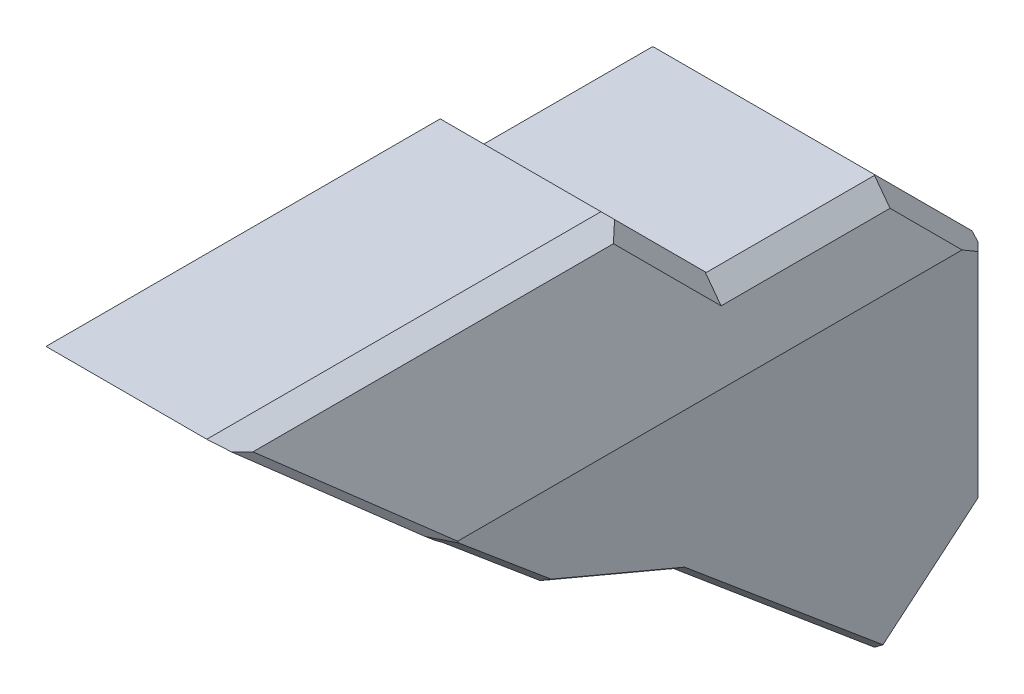
from build123d import *
from OCP.BRepFilletAPI import BRepFilletAPI_MakeChamfer

# Parameters (mm, degrees)
EXTRUDE_1_DEPTH          = 250
EXTRUDE_1_2_DEPTH        = 250
CUT_EXTRUDE_1_DEPTH      = 273.642623227
CUT_EXTRUDE_1_DEPTH_BACK = 273.642623227
EXTRUDE_5_REACH          = 274.643
EXTRUDE_6_REACH          = 274.643
EXTRUDE_13_DEPTH         = 52
SKETCH_15_W              = 2
SKETCH_15_H              = 5
SKETCH_15_W_2            = 4
SKETCH_15_H_2            = 2
EXTRUDE_14_DEPTH         = 12
SKETCH_16_W              = 10
SKETCH_16_H              = 32
EXTRUDE_15_DEPTH         = 12
CUT_EXTRUDE_2_REACH      = 279.173
SKETCH_17_R              = 1.5
SKETCH_18_R              = 1.5
SKETCH_18_R_2            = 4.615350253
CUT_EXTRUDE_3_DEPTH      = 10
CHAMFER_1_SIZE           = 3.464101615
CHAMFER_1_SIZE_2         = 2
CHAMFER_1_SIZE_3         = 2.416402179
CHAMFER_2_SIZE           = 4
CHAMFER_2_SIZE2          = 5.580634967
CHAMFER_2_SIZE2_2        = 6.901718256
CHAMFER_4_SIZE           = 2


with BuildPart() as part:
    # 草图2 → 凸台-拉伸1 (new body)
    with BuildSketch(Plane.XY):
        Polygon((-53, 45), (-34, 95), (-30.790701011, 95), (-50, 44.449213187), (-50, -65), (-53, -65), align=None)
    extrude(amount=EXTRUDE_1_DEPTH)


with BuildPart() as body_2:
    # 草图2 → Extrude 1 2 (new body)
    with BuildSketch(Plane.XY):
        Polygon((50, 44.449213187), (50, -65), (53, -65), (53, 45), (34, 95), (30.790701011, 95), align=None)
    extrude(amount=EXTRUDE_1_2_DEPTH)


with BuildPart() as cut_extrude_1_tool:
    # 草图3 → 切除-拉伸1 (new, two sides: drawn at the far end of the back side and taken through both)
    with BuildSketch(Plane(origin=(0, 0, 0), x_dir=(0, 0, -1), z_dir=(1, 0, 0)).offset(-CUT_EXTRUDE_1_DEPTH_BACK)):
        Polygon((0, -35), (-35.752607778, -65), (-107.257823333, -5), (-154.659712592, 15), (-250, 95), (-250, -65), (-250, -69.557889813), (0, -69.557889813), (0, -65), align=None)
        Polygon((-110, 95), (-85, 70), (-25, 70), (0, 45), (0, 95), align=None)
    extrude(amount=CUT_EXTRUDE_1_DEPTH + CUT_EXTRUDE_1_DEPTH_BACK)


with BuildPart() as part_1:
    add(part.part)

    # 切除-拉伸1: cut by cut_extrude_1_tool
    add(cut_extrude_1_tool.part, mode=Mode.SUBTRACT)

    # 草图5<2> → 凸台-拉伸6 (add, up to next)
    with BuildSketch(Plane(origin=(0, 0, 0), x_dir=(0, 0, -1), z_dir=(1, 0, 0)), mode=Mode.PRIVATE) as extrude_6_sk1:
        Polygon((-250, 95), (-110, 95), (-85, 70), (-25, 70), (0, 45), (0, -35), (-4, -35), (-4, 43.343145751), (-26.656854249, 66), (-86.656854249, 66), (-111.656854249, 91), (-245.23298563, 91), align=None)
    extrude_6_tool1 = extrude(extrude_6_sk1.sketch, amount=-EXTRUDE_6_REACH, mode=Mode.PRIVATE) - part_1.part


with BuildPart() as body_2_1:
    add(body_2.part)

    # 切除-拉伸1: cut by cut_extrude_1_tool
    add(cut_extrude_1_tool.part, mode=Mode.SUBTRACT)

    # 草图5 → 凸台-拉伸5 (add, up to next)
    with BuildSketch(Plane(origin=(0, 0, 0), x_dir=(0, 0, -1), z_dir=(1, 0, 0)), mode=Mode.PRIVATE) as extrude_5_sk1:
        Polygon((-250, 95), (-110, 95), (-85, 70), (-25, 70), (0, 45), (0, -35), (-4, -35), (-4, 43.343145751), (-26.656854249, 66), (-86.656854249, 66), (-111.656854249, 91), (-245.23298563, 91), align=None)
    extrude_5_tool1 = extrude(extrude_5_sk1.sketch, amount=EXTRUDE_5_REACH, mode=Mode.PRIVATE) - body_2_1.part
    add(extrude_5_tool1.solids().sort_by_distance((0, 92.182199, 180))[0])


with BuildPart() as part_2:
    add(part_1.part)

    add(body_2_1.part)  # 凸台-拉伸6 merges body 2
    add(extrude_6_tool1.solids().sort_by_distance((0, 92.182199, 180))[0])

    # 草图13 → 凸台-拉伸13 (add)
    with BuildSketch(Plane.XY.offset(4)):
        Polygon((-5, 15), (35.7, 15), (35.7, -15), (-5, -15), (-5, -19), (38.7, -19), (38.7, 18), (-5, 18), align=None)
    extrude(amount=EXTRUDE_13_DEPTH)

    # 草图15 → 凸台-拉伸14 (add)
    with BuildSketch(Plane.XY.offset(4)):
        with Locations((29.7, 12.5)):
            Rectangle(SKETCH_15_W, SKETCH_15_H)
        with Locations((29.7, -12.5)):
            Rectangle(SKETCH_15_W, SKETCH_15_H)
        with Locations((-10, 0)):
            Rectangle(SKETCH_15_W_2, SKETCH_15_H_2)
    extrude(amount=EXTRUDE_14_DEPTH)

    # 草图16 → 凸台-拉伸15 (add)
    with BuildSketch(Plane.XY.offset(4)):
        with Locations((-24.8, 0)):
            Rectangle(SKETCH_16_W, SKETCH_16_H)
    extrude(amount=EXTRUDE_15_DEPTH)

    # 草图17 → 切除-拉伸2 (cut, up to next)
    with BuildSketch(Plane(origin=(-19.8, 0, 0), x_dir=(0, 0, -1), z_dir=(1, 0, 0)), mode=Mode.PRIVATE) as cut_extrude_2_sk1:
        with Locations(Location((-11.5, 8.5, 0), (0, 0, 90))):
            Circle(SKETCH_17_R)
    cut_extrude_2_tool1 = extrude(cut_extrude_2_sk1.sketch, amount=-CUT_EXTRUDE_2_REACH, mode=Mode.PRIVATE) & part_2.part
    # 草图17 → 切除-拉伸2 (cut, up to next)
    with BuildSketch(Plane(origin=(-19.8, 0, 0), x_dir=(0, 0, -1), z_dir=(1, 0, 0)), mode=Mode.PRIVATE) as cut_extrude_2_sk2:
        with Locations(Location((-11.5, -8.5, 0), (0, 0, 90))):
            Circle(SKETCH_17_R)
    cut_extrude_2_tool2 = extrude(cut_extrude_2_sk2.sketch, amount=-CUT_EXTRUDE_2_REACH, mode=Mode.PRIVATE) & part_2.part
    add(cut_extrude_2_tool1.solids().sort_by_distance((-19.8, 8.5, 11.5))[0], mode=Mode.SUBTRACT)
    add(cut_extrude_2_tool2.solids().sort_by_distance((-19.8, -8.5, 11.5))[0], mode=Mode.SUBTRACT)

    # 草图18 → 切除-拉伸3 (cut)
    with BuildSketch(Plane(origin=(0, 0, 0), x_dir=(-1, 0, 0), z_dir=(0, 0, -1))):
        with Locations((20.5, 0)):
            Circle(SKETCH_18_R)
        with Locations((14.495689014, -14.495689014)):
            Circle(SKETCH_18_R)
        with Locations((0, -20.5)):
            Circle(SKETCH_18_R)
        with Locations((-14.495689014, -14.495689014)):
            Circle(SKETCH_18_R)
        with Locations((-20.5, 0)):
            Circle(SKETCH_18_R)
        with Locations((-14.495689014, 14.495689014)):
            Circle(SKETCH_18_R)
        with Locations((0, 20.5)):
            Circle(SKETCH_18_R)
        with Locations((14.495689014, 14.495689014)):
            Circle(SKETCH_18_R)
        Circle(SKETCH_18_R_2)
    extrude(amount=-CUT_EXTRUDE_3_DEPTH, mode=Mode.SUBTRACT)

    # 倒角1
    # the kernel refuses this chamfer: 3.464101615, 2.416402179, 2 mm, written as the material it takes off along each edge
    with BuildSketch(Plane(origin=(53, 9.239383761, 147.794477493), x_dir=(-1, 0, 0), z_dir=(0, 0.6427876096865404, 0.7660444431189771))) as chamfer_1_piece_1:
        Polygon((CHAMFER_1_SIZE, 0), (0, -CHAMFER_1_SIZE_2), (0, 0), align=None)
    extrude(amount=70.868920247, mode=Mode.SUBTRACT)
    with BuildSketch(Plane(origin=(53, -8.483850163, 99.000769351), x_dir=(-3.552713678800504e-15, 0.9213479550614352, -0.38873891714634334), z_dir=(0, 0.38873891714634334, 0.9213479550614352))) as chamfer_1_piece_2_section:
        Polygon((CHAMFER_1_SIZE_2, 0), (0, CHAMFER_1_SIZE), (0, 0), align=None)
    chamfer_1_piece_2 = extrude(amount=69.37226796, mode=Mode.PRIVATE)
    chamfer_1_piece_2 = split(chamfer_1_piece_2, bisect_by=Plane(origin=(53.276585969, -8.850832142, 99.308703795), z_dir=(0.49999999999999917, -0.663413948168938, 0.5566703992264205)), keep=Keep.TOP, mode=Mode.PRIVATE)
    add(chamfer_1_piece_2, mode=Mode.SUBTRACT)
    with BuildSketch(Plane(origin=(53, -70.760616239, 28.887372679), x_dir=(-3.5527136788004907e-15, 0.7660444431189773, -0.6427876096865404), z_dir=(0, 0.6427876096865404, 0.7660444431189772))) as chamfer_1_piece_3_section:
        Polygon((CHAMFER_1_SIZE_2, 0), (0, CHAMFER_1_SIZE), (0, 0), align=None)
    chamfer_1_piece_3 = extrude(amount=111.267285494, mode=Mode.PRIVATE)
    chamfer_1_piece_3 = split(chamfer_1_piece_3, bisect_by=Plane(origin=(39.090434661, -48.563433238, 19.521845967), z_dir=(0.49999999999999994, -0.7979107348080464, 0.33665777768838756)), keep=Keep.TOP, mode=Mode.PRIVATE)
    add(chamfer_1_piece_3, mode=Mode.SUBTRACT)
    with BuildSketch(Plane(origin=(53, -29.239383761, -6.865235099), x_dir=(0, 0.766044443118976, 0.6427876096865418), z_dir=(0, -0.6427876096865418, 0.766044443118976))) as chamfer_1_piece_4:
        Polygon((CHAMFER_1_SIZE_2, 0), (0, CHAMFER_1_SIZE), (0, 0), align=None)
    extrude(amount=64.595570688, mode=Mode.SUBTRACT)
    with BuildSketch(Plane(origin=(-53, 5.206952393, 142.988812924), x_dir=(1, 0, 0), z_dir=(0, 0.6427876096865404, 0.7660444431189771))) as chamfer_1_piece_5:
        Polygon((CHAMFER_1_SIZE_2, 0), (0, CHAMFER_1_SIZE), (0, 0), align=None)
    extrude(amount=70.868920247, mode=Mode.SUBTRACT)
    with BuildSketch(Plane(origin=(-53, -8.483850163, 99.000769351), x_dir=(0, 0.9213479550614352, -0.3887389171463434), z_dir=(0, 0.38873891714634334, 0.9213479550614352))) as chamfer_1_piece_6_section:
        Polygon((CHAMFER_1_SIZE, 0), (0, -CHAMFER_1_SIZE_2), (0, 0), align=None)
    chamfer_1_piece_6 = extrude(amount=75.645617519, mode=Mode.PRIVATE)
    chamfer_1_piece_6 = split(chamfer_1_piece_6, bisect_by=Plane(origin=(-52.642611372, -8.325785763, 98.868137571), z_dir=(-0.8660254037844394, -0.3830222215594882, 0.3213938048432697)), keep=Keep.TOP, mode=Mode.PRIVATE)
    add(chamfer_1_piece_6, mode=Mode.SUBTRACT)
    with BuildSketch(Plane(origin=(-53, -70.760616239, 28.887372679), x_dir=(0, 0.7660444431189772, -0.6427876096865404), z_dir=(0, 0.6427876096865404, 0.7660444431189772))) as chamfer_1_piece_7_section:
        Polygon((CHAMFER_1_SIZE, 0), (0, -CHAMFER_1_SIZE_2), (0, 0), align=None)
    chamfer_1_piece_7 = extrude(amount=111.267285494, mode=Mode.PRIVATE)
    chamfer_1_piece_7 = split(chamfer_1_piece_7, bisect_by=Plane(origin=(-38.456460064, -63.024318482, 25.623242123), z_dir=(-0.8660254037844407, -0.4606739775307143, 0.1943694585731703)), keep=Keep.TOP, mode=Mode.PRIVATE)
    add(chamfer_1_piece_7, mode=Mode.SUBTRACT)
    with BuildSketch(Plane(origin=(-53, -29.239383761, -6.865235099), x_dir=(0, 0.766044443118976, 0.6427876096865417), z_dir=(0, -0.6427876096865418, 0.766044443118976))) as chamfer_1_piece_8:
        Polygon((CHAMFER_1_SIZE, 0), (0, -CHAMFER_1_SIZE_2), (0, 0), align=None)
    extrude(amount=64.595570688, mode=Mode.SUBTRACT)
    # the kernel refuses this chamfer: 3.464101615, 2.416402179, 2 mm, written as the material it takes off along each edge
    with BuildSketch(Plane(origin=(56.90581755, 34.721532764, 178.162920115), x_dir=(-0.9714404796101728, -0.15252280601661522, -0.1817696020229335), z_dir=(-0.2372833634597202, 0.6244299038413693, 0.7441665812262069))) as chamfer_1_2_piece_1:
        Polygon((CHAMFER_1_SIZE_2, 0), (CHAMFER_1_SIZE_3 * 0.272112591588, -CHAMFER_1_SIZE_3 * 0.962265419331), (0, 0), align=None)
    extrude(amount=102.745515014, mode=Mode.SUBTRACT)
    with BuildSketch(Plane(origin=(-53.505772516, 43.669019695, 188.82611981), x_dir=(0.9714404796101727, -0.15252280601661541, -0.1817696020229337), z_dir=(0.23728336345972048, 0.6244299038413692, 0.7441665812262068))) as chamfer_1_2_piece_2:
        Polygon((CHAMFER_1_SIZE_2, 0), (CHAMFER_1_SIZE_3 * 0.272112591588, CHAMFER_1_SIZE_3 * 0.962265419331), (0, 0), align=None)
    extrude(amount=88.416465626, mode=Mode.SUBTRACT)

    # 倒角2: one chamfer whose edges measure the first distance from different faces: ONE call of the kernel's chamfer builder (chamfer() names one face for all edges)
    chamfer_2_edges_1 = [part_2.edges().sort_by_distance(p)[0] for p in [
        (45.905350506, 55.224606594, 15.881460843),
    ]]
    chamfer_2_side_1 = [part_2.faces().sort_by_distance(p)[0] for p in [
        (0, 54.321436841, 14.97829109),
    ]]
    chamfer_2_edges_2 = [part_2.edges().sort_by_distance(p)[0] for p in [
        (-45.905350506, 55.224606594, 15.881460843),
        (-37.060701011, 78.5, 99.156854249),
    ]]
    chamfer_2_side_2 = [part_2.faces().sort_by_distance(p)[0] for p in [
        (-41.912460378, 65.732212193, 134.225656141),
    ]]
    chamfer_2_edges_3 = [part_2.edges().sort_by_distance(p)[0] for p in [
        (41.810701011, 66, 56.656854249),
    ]]
    chamfer_2_side_3 = [part_2.faces().sort_by_distance(p)[0] for p in [
        (0, 66, 56.656854249),
    ]]
    chamfer_2_edges_4 = [part_2.edges().sort_by_distance(p)[0] for p in [
        (-41.810701011, 66, 56.656854249),
        (-32.310701011, 91, 178.44491994),
    ]]
    chamfer_2_side_4 = [part_2.faces().sort_by_distance(p)[0] for p in [
        (-41.912460378, 65.732212193, 134.225656141),
    ]]
    chamfer_2_edges_5 = [part_2.edges().sort_by_distance(p)[0] for p in [
        (37.060701011, 78.5, 99.156854249),
    ]]
    chamfer_2_side_5 = [part_2.faces().sort_by_distance(p)[0] for p in [
        (0, 77.965966209, 98.622820458),
    ]]
    chamfer_2_edges_6 = [part_2.edges().sort_by_distance(p)[0] for p in [
        (32.310701011, 91, 178.44491994),
    ]]
    chamfer_2_side_6 = [part_2.faces().sort_by_distance(p)[0] for p in [
        (0, 91, 178.44491994),
    ]]
    chamfer_2_edges_7 = [part_2.edges().sort_by_distance(p)[0] for p in [
        (-48.25, 57.5, 12.5),
        (48.25, 57.5, 12.5),
    ]]
    chamfer_2_side_7 = [part_2.faces().sort_by_distance(p)[0] for p in [
        (0, 57.089810017, 12.089810017),
    ]]
    chamfer_2_edges_8 = [part_2.edges().sort_by_distance(p)[0] for p in [
        (-43.5, 70, 55),
        (43.5, 70, 55),
    ]]
    chamfer_2_side_8 = [part_2.faces().sort_by_distance(p)[0] for p in [
        (0, 70, 55),
    ]]
    chamfer_2_edges_9 = [part_2.edges().sort_by_distance(p)[0] for p in [
        (-38.75, 82.5, 97.5),
        (38.75, 82.5, 97.5),
    ]]
    chamfer_2_side_9 = [part_2.faces().sort_by_distance(p)[0] for p in [
        (0, 81.989247312, 96.989247312),
    ]]
    chamfer_2_edges_10 = [part_2.edges().sort_by_distance(p)[0] for p in [
        (-34, 95, 178.191299722),
    ]]
    chamfer_2_side_10 = [part_2.faces().sort_by_distance(p)[0] for p in [
        (0, 95, 179.946140148),
    ]]
    chamfer_2_edges_11 = [part_2.edges().sort_by_distance(p)[0] for p in [
        (34, 95, 178.191299722),
    ]]
    chamfer_2_side_11 = [part_2.faces().sort_by_distance(p)[0] for p in [
        (44.287923043, 67.926518307, 130.959754024),
    ]]
    chamfer_2 = BRepFilletAPI_MakeChamfer(part_2.part.solid().wrapped)
    for e in chamfer_2_edges_1:
        chamfer_2.Add(CHAMFER_2_SIZE, CHAMFER_2_SIZE2, e.wrapped, chamfer_2_side_1[0].wrapped)  # the first distance lies on this face
    for e in chamfer_2_edges_2:
        chamfer_2.Add(CHAMFER_2_SIZE, CHAMFER_2_SIZE2, e.wrapped, chamfer_2_side_2[0].wrapped)  # the first distance lies on this face
    for e in chamfer_2_edges_3:
        chamfer_2.Add(CHAMFER_2_SIZE, CHAMFER_2_SIZE2_2, e.wrapped, chamfer_2_side_3[0].wrapped)  # the first distance lies on this face
    for e in chamfer_2_edges_4:
        chamfer_2.Add(CHAMFER_2_SIZE, CHAMFER_2_SIZE2_2, e.wrapped, chamfer_2_side_4[0].wrapped)  # the first distance lies on this face
    for e in chamfer_2_edges_5:
        chamfer_2.Add(CHAMFER_2_SIZE, CHAMFER_2_SIZE2, e.wrapped, chamfer_2_side_5[0].wrapped)  # the first distance lies on this face
    for e in chamfer_2_edges_6:
        chamfer_2.Add(CHAMFER_2_SIZE, CHAMFER_2_SIZE2_2, e.wrapped, chamfer_2_side_6[0].wrapped)  # the first distance lies on this face
    for e in chamfer_2_edges_7:
        chamfer_2.Add(CHAMFER_2_SIZE, CHAMFER_2_SIZE2, e.wrapped, chamfer_2_side_7[0].wrapped)  # the first distance lies on this face
    for e in chamfer_2_edges_8:
        chamfer_2.Add(CHAMFER_2_SIZE, CHAMFER_2_SIZE2_2, e.wrapped, chamfer_2_side_8[0].wrapped)  # the first distance lies on this face
    for e in chamfer_2_edges_9:
        chamfer_2.Add(CHAMFER_2_SIZE, CHAMFER_2_SIZE2, e.wrapped, chamfer_2_side_9[0].wrapped)  # the first distance lies on this face
    for e in chamfer_2_edges_10:
        chamfer_2.Add(CHAMFER_2_SIZE, CHAMFER_2_SIZE2_2, e.wrapped, chamfer_2_side_10[0].wrapped)  # the first distance lies on this face
    for e in chamfer_2_edges_11:
        chamfer_2.Add(CHAMFER_2_SIZE, CHAMFER_2_SIZE2_2, e.wrapped, chamfer_2_side_11[0].wrapped)  # the first distance lies on this face
    add(Compound.cast(chamfer_2.Shape()), mode=Mode.REPLACE)

    # 倒角4
    chamfer_4_edges = [part_2.edges().sort_by_distance(p)[0] for p in [
        (-50, 2.305035055, 4),
        (50, 2.153776079, 4),
        (-53, 5.015350076, 0),
        (53, 4.059725616, 0),
    ]]
    chamfer(chamfer_4_edges, length=CHAMFER_4_SIZE)


solid = part_2.part
